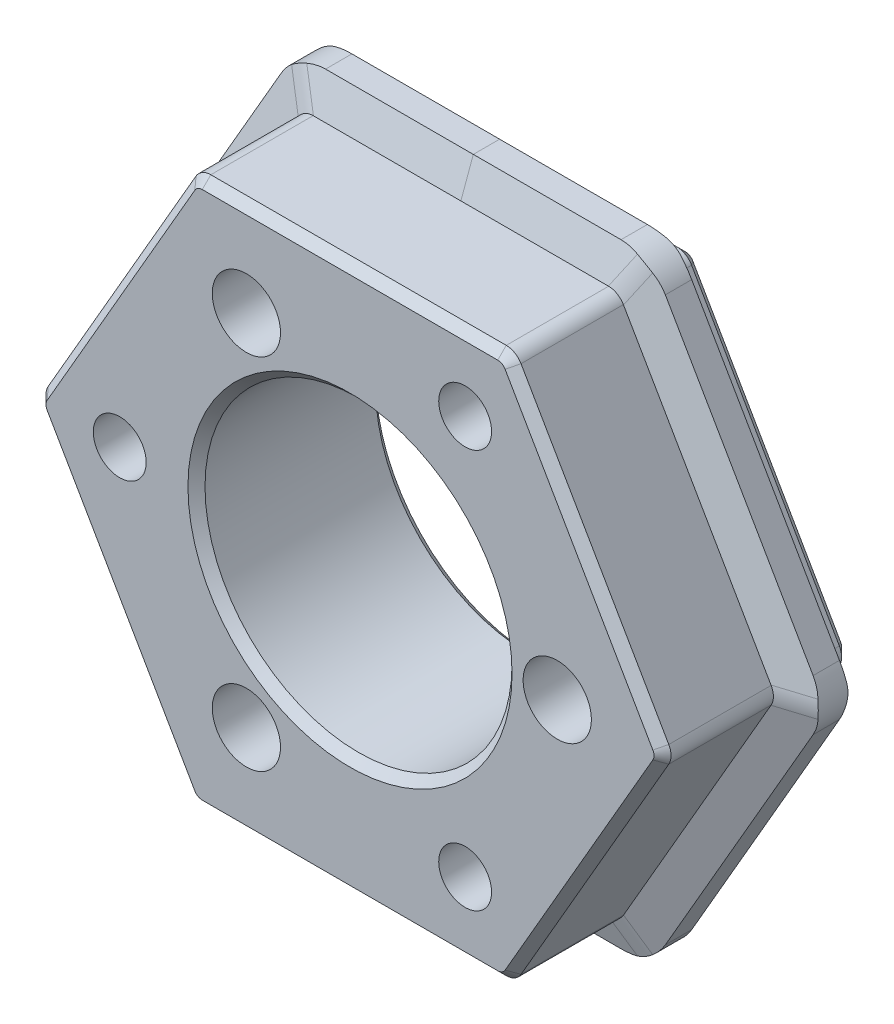
from build123d import *

# Parameters (mm, degrees)
EXTRUDE_1_DEPTH              = 5.5
HOLE_WIZARD_M3_1_D           = 3.1
HOLE_WIZARD_M3_1_CBORE_D     = 6
HOLE_WIZARD_M3_1_CBORE_DEPTH = 3.1
F_4_0MM_1_D                  = 4
F_4_0MM_1_DEPTH              = 3
F_4_0MM_1_TIP                = 1.2017212380551205
SKETCH_8_R                   = 9
CUT_EXTRUDE_1_DEPTH          = 27.801741236966944
FILLET_1_R                   = 3
FILLET_2_R                   = 1
CHAMFER_1_SIZE               = 0.5


with BuildPart() as part:
    # 草图2 → 凸台-拉伸1 (new, symmetric)
    with BuildSketch(Plane.XY):
        Polygon((9.237604307034019, 16.000000000000007), (-9.237604307034015, 16.000000000000007), (-18.475208614068023, -1.013e-14), (-9.237604307033997, -16.000000000000014), (9.237604307034022, -16.00000000000001), (18.475208614068038, 6.49e-15), align=None)
    extrude(amount=EXTRUDE_1_DEPTH, both=True)

    # M3 六角圆柱头螺钉的柱形沉头孔1 (through all)
    with Locations(Plane(origin=(0, 0, -5.5), x_dir=(-1, 0, 0), z_dir=(0, 0, -1))):
        with Locations((-6.75, 11.691342951), (13.5, 0), (-6.75, -11.691342951)):
            CounterBoreHole(HOLE_WIZARD_M3_1_D / 2, HOLE_WIZARD_M3_1_CBORE_D / 2, HOLE_WIZARD_M3_1_CBORE_DEPTH)

    # Ø4.0mm 暗销孔1
    with Locations(Plane.XY.offset(5.5)):
        with Locations((-6.075, 10.522208656), (12.15, 0), (-6.075, -10.522208656)):
            Hole(F_4_0MM_1_D / 2, depth=F_4_0MM_1_DEPTH)
            with Locations((0, 0, -(F_4_0MM_1_DEPTH + F_4_0MM_1_TIP / 2))):  # 118° drill point
                Cone(0, F_4_0MM_1_D / 2, F_4_0MM_1_TIP, mode=Mode.SUBTRACT)

    # 草图8 → 切除-拉伸1 (cut, through all)
    with BuildSketch(Plane.XY.offset(5.5)):
        Circle(SKETCH_8_R)
    extrude(amount=-CUT_EXTRUDE_1_DEPTH, mode=Mode.SUBTRACT)

    # 扫描1: sweep along a path in 草图10
    with BuildLine(Plane(origin=(0, 0, -2.4999999999999996), x_dir=(-1, 0, 0), z_dir=(0, 0, -1))) as sweep_1_path:
        Line((-9.237604307034019, 16.000000000000007), (-18.475208614068038, 6.49e-15))
        Line((-18.475208614068038, 6.49e-15), (-9.237604307034022, -16.00000000000001))
        Line((-9.237604307034022, -16.00000000000001), (9.237604307033997, -16.000000000000014))
        Line((9.237604307033997, -16.000000000000014), (18.475208614068023, -1.013e-14))
        Line((18.475208614068023, -1.013e-14), (9.237604307034015, 16.000000000000007))
        Line((9.237604307034015, 16.000000000000007), (-9.237604307034019, 16.000000000000007))
    # 草图11 → 扫描1 (sweep)
    with BuildSketch(Plane(origin=(0, 0, 0), x_dir=(0, 0, -1), z_dir=(1, 0, 0))):
        Polygon((1.0000000000000018, 16.00000000000001), (1.7279404685324007, 18.00000000000001), (3.2720595314676024, 18.00000000000001), (4.000000000000002, 16.000000000000007), align=None)
    sweep(path=sweep_1_path.line, transition=Transition.RIGHT)

    # 圆角1
    # the kernel refuses this fillet: 3 mm, written as the material it takes off along each edge
    with BuildSketch(Plane(origin=(11.013072226794984, -19.07520064423464, -2.8807185011023595), x_dir=(0.8275631402450503, 0.5371571559215875, 0.1630994750144294), z_dir=(-0.47687096271147394, 0.8259647360705569, -0.3006265784832199))) as fillet_1_piece_1_section:
        with BuildLine():
            CenterArc((FILLET_1_R * 0.173566836013, -FILLET_1_R), FILLET_1_R, 90.00000000000018, 19.693103879667916)
            Line((-FILLET_1_R * 0.163415104569, -FILLET_1_R * 0.0584888892203), (0, 0))
            Line((0, 0), (FILLET_1_R * 0.173566836013, 2e-17))
        make_face()
    fillet_1_piece_1 = extrude(amount=5.024913422108496, mode=Mode.PRIVATE)
    fillet_1_piece_1 = split(fillet_1_piece_1, bisect_by=Plane(origin=(8.777859638657976, -16.796301124136228, -3.4014164671004337), z_dir=(0.8660254037844388, -0.4999999999999997, 0)), keep=Keep.TOP, mode=Mode.PRIVATE)
    fillet_1_piece_1 = split(fillet_1_piece_1, bisect_by=Plane(origin=(10.157093643786105, -16.00000000000001, -3.4014164671004337), z_dir=(1.9e-16, -1, 0)), keep=Keep.TOP, mode=Mode.PRIVATE)
    add(fillet_1_piece_1, mode=Mode.SUBTRACT)
    with BuildSketch(Plane(origin=(11.013072226794984, -19.07520064423464, -2.8807185011023595), x_dir=(0.8275631402450503, 0.5371571559215875, 0.1630994750144294), z_dir=(-0.47687096271147394, 0.8259647360705569, -0.3006265784832199))) as fillet_1_piece_2_section:
        with BuildLine():
            CenterArc((FILLET_1_R * 0.173566836013, -FILLET_1_R), FILLET_1_R, 90.00000000000018, 19.693103879667916)
            Line((-FILLET_1_R * 0.163415104569, -FILLET_1_R * 0.0584888892203), (0, 0))
            Line((0, 0), (FILLET_1_R * 0.173566836013, 2e-17))
        make_face()
    fillet_1_piece_2 = extrude(amount=5.024913422108496, mode=Mode.PRIVATE)
    fillet_1_piece_2 = split(fillet_1_piece_2, bisect_by=Plane(origin=(9.094560258170244, -16.24775956035244, -3.9675238385528897), z_dir=(-0.8660254037844388, 0.4999999999999997, 0)), keep=Keep.TOP, mode=Mode.PRIVATE)
    fillet_1_piece_2 = split(fillet_1_piece_2, bisect_by=Plane(origin=(8.9515162091671, -16.00000000000001, -3.9675238385528897), z_dir=(1.9e-16, -1, 0)), keep=Keep.TOP, mode=Mode.PRIVATE)
    add(fillet_1_piece_2, mode=Mode.SUBTRACT)
    with BuildSketch(Plane(origin=(11.013072226794984, -19.07520064423464, -2.8807185011023595), x_dir=(0.8275631402450503, 0.5371571559215875, 0.1630994750144294), z_dir=(-0.47687096271147394, 0.8259647360705569, -0.3006265784832199))) as fillet_1_piece_3_section:
        with BuildLine():
            CenterArc((FILLET_1_R * 0.173566836013, -FILLET_1_R), FILLET_1_R, 90.00000000000018, 19.693103879667916)
            Line((-FILLET_1_R * 0.163415104569, -FILLET_1_R * 0.0584888892203), (0, 0))
            Line((0, 0), (FILLET_1_R * 0.173566836013, 2e-17))
        make_face()
    fillet_1_piece_3 = extrude(amount=5.024913422108496, mode=Mode.PRIVATE)
    fillet_1_piece_3 = split(fillet_1_piece_3, bisect_by=Plane(origin=(9.380648355967478, -15.752240439526894, -3.967523838552888), z_dir=(0.8660254037844388, -0.4999999999999997, 0)), keep=Keep.TOP, mode=Mode.PRIVATE)
    fillet_1_piece_3 = split(fillet_1_piece_3, bisect_by=Plane(origin=(9.523692404761562, -16.00000000000001, -3.967523838552888), z_dir=(-1.9e-16, 1, 0)), keep=Keep.TOP, mode=Mode.PRIVATE)
    add(fillet_1_piece_3, mode=Mode.SUBTRACT)
    with BuildSketch(Plane(origin=(8.616836925652304, -14.924799355765398, -0.6086589696347597), x_dir=(0.8275631402450506, 0.5371571559215875, -0.16309947501442706), z_dir=(0.47687096271147433, -0.8259647360705564, -0.3006265784832201))) as fillet_1_piece_4_section:
        with BuildLine():
            CenterArc((FILLET_1_R * 0.173566836013, -FILLET_1_R), FILLET_1_R, 90, 19.693103879668044)
            Line((-FILLET_1_R * 0.163415104569, -FILLET_1_R * 0.0584888892203), (0, 0))
            Line((0, 0), (FILLET_1_R * 0.173566836013, 1e-17))
        make_face()
    fillet_1_piece_4 = extrude(amount=5.024913422108493, mode=Mode.PRIVATE)
    fillet_1_piece_4 = split(fillet_1_piece_4, bisect_by=Plane(origin=(9.094560258170246, -16.24775956035244, -1.0324761614471132), z_dir=(-0.8660254037844388, 0.4999999999999997, 0)), keep=Keep.TOP, mode=Mode.PRIVATE)
    fillet_1_piece_4 = split(fillet_1_piece_4, bisect_by=Plane(origin=(8.951516209167089, -16.00000000000001, -1.0324761614471132), z_dir=(1.9e-16, -1, 0)), keep=Keep.TOP, mode=Mode.PRIVATE)
    add(fillet_1_piece_4, mode=Mode.SUBTRACT)
    with BuildSketch(Plane(origin=(8.616836925652304, -14.924799355765398, -0.6086589696347597), x_dir=(0.8275631402450506, 0.5371571559215875, -0.16309947501442706), z_dir=(0.47687096271147433, -0.8259647360705564, -0.3006265784832201))) as fillet_1_piece_5_section:
        with BuildLine():
            CenterArc((FILLET_1_R * 0.173566836013, -FILLET_1_R), FILLET_1_R, 90, 19.693103879668044)
            Line((-FILLET_1_R * 0.163415104569, -FILLET_1_R * 0.0584888892203), (0, 0))
            Line((0, 0), (FILLET_1_R * 0.173566836013, 1e-17))
        make_face()
    fillet_1_piece_5 = extrude(amount=5.024913422108493, mode=Mode.PRIVATE)
    fillet_1_piece_5 = split(fillet_1_piece_5, bisect_by=Plane(origin=(9.380648355967471, -15.752240439526908, -1.032476161447135), z_dir=(0.8660254037844388, -0.4999999999999997, 0)), keep=Keep.TOP, mode=Mode.PRIVATE)
    fillet_1_piece_5 = split(fillet_1_piece_5, bisect_by=Plane(origin=(9.523692404761544, -16.00000000000001, -1.032476161447135), z_dir=(-1.9e-16, 1, 0)), keep=Keep.TOP, mode=Mode.PRIVATE)
    add(fillet_1_piece_5, mode=Mode.SUBTRACT)
    with BuildSketch(Plane(origin=(8.616836925652304, -14.924799355765398, -0.6086589696347597), x_dir=(0.8275631402450506, 0.5371571559215875, -0.16309947501442706), z_dir=(0.47687096271147433, -0.8259647360705564, -0.3006265784832201))) as fillet_1_piece_6_section:
        with BuildLine():
            CenterArc((FILLET_1_R * 0.173566836013, -FILLET_1_R), FILLET_1_R, 90, 19.693103879668044)
            Line((-FILLET_1_R * 0.163415104569, -FILLET_1_R * 0.0584888892203), (0, 0))
            Line((0, 0), (FILLET_1_R * 0.173566836013, 1e-17))
        make_face()
    fillet_1_piece_6 = extrude(amount=5.024913422108493, mode=Mode.PRIVATE)
    fillet_1_piece_6 = split(fillet_1_piece_6, bisect_by=Plane(origin=(8.777859638657999, -16.79630112413619, -1.598583532899566), z_dir=(0.8660254037844388, -0.4999999999999997, 0)), keep=Keep.TOP, mode=Mode.PRIVATE)
    fillet_1_piece_6 = split(fillet_1_piece_6, bisect_by=Plane(origin=(10.157093643786116, -16.00000000000001, -1.598583532899566), z_dir=(1.9e-16, -1, 0)), keep=Keep.TOP, mode=Mode.PRIVATE)
    add(fillet_1_piece_6, mode=Mode.SUBTRACT)
    with BuildSketch(Plane(origin=(10.392304845413273, -18.000000000000014, 2.602186550389802), x_dir=(0.4999999999999995, 0.8660254037844389, 0), z_dir=(1.3e-16, 1e-17, -1))) as fillet_1_piece_7:
        with BuildLine():
            CenterArc((FILLET_1_R * 0.57735026919, -FILLET_1_R), FILLET_1_R, 90.00000000000004, 59.99999999999996)
            Line((-FILLET_1_R * 0.288675134595, -FILLET_1_R * 0.5), (0, 0))
            Line((0, 0), (FILLET_1_R * 0.57735026919, -3e-17))
        make_face()
    extrude(amount=10.204373100779607, mode=Mode.SUBTRACT)
    with BuildSketch(Plane(origin=(22.02614445358997, -7.11e-15, -2.8807185011023595), x_dir=(-0.051410172730167014, 0.9852692806486323, 0.16309947501442495), z_dir=(-0.9537419254229482, 0, -0.30062657848321994))) as fillet_1_piece_8_section:
        with BuildLine():
            CenterArc((FILLET_1_R * 0.173566836013, -FILLET_1_R), FILLET_1_R, 89.9999999999999, 19.693103879668058)
            Line((-FILLET_1_R * 0.163415104569, -FILLET_1_R * 0.0584888892203), (0, 0))
            Line((0, 0), (FILLET_1_R * 0.173566836013, 0))
        make_face()
    fillet_1_piece_8 = extrude(amount=5.024913422108487, mode=Mode.PRIVATE)
    fillet_1_piece_8 = split(fillet_1_piece_8, bisect_by=Plane(origin=(18.93495328244408, -0.796301124136203, -3.4014164671004345), z_dir=(0.8660254037844385, 0.5000000000000003, 0)), keep=Keep.TOP, mode=Mode.PRIVATE)
    fillet_1_piece_8 = split(fillet_1_piece_8, bisect_by=Plane(origin=(18.934953282444077, 0.7963011241362139, -3.4014164671004345), z_dir=(0.8660254037844388, -0.4999999999999997, 0)), keep=Keep.TOP, mode=Mode.PRIVATE)
    add(fillet_1_piece_8, mode=Mode.SUBTRACT)
    with BuildSketch(Plane(origin=(22.02614445358997, -7.11e-15, -2.8807185011023595), x_dir=(-0.051410172730167014, 0.9852692806486323, 0.16309947501442495), z_dir=(-0.9537419254229482, 0, -0.30062657848321994))) as fillet_1_piece_9_section:
        with BuildLine():
            CenterArc((FILLET_1_R * 0.173566836013, -FILLET_1_R), FILLET_1_R, 89.9999999999999, 19.693103879668058)
            Line((-FILLET_1_R * 0.163415104569, -FILLET_1_R * 0.0584888892203), (0, 0))
            Line((0, 0), (FILLET_1_R * 0.173566836013, 0))
        make_face()
    fillet_1_piece_9 = extrude(amount=5.024913422108487, mode=Mode.PRIVATE)
    fillet_1_piece_9 = split(fillet_1_piece_9, bisect_by=Plane(origin=(18.618252662931823, -0.24775956035243224, -3.9675238385528875), z_dir=(-0.8660254037844385, -0.5000000000000003, 0)), keep=Keep.TOP, mode=Mode.PRIVATE)
    fillet_1_piece_9 = split(fillet_1_piece_9, bisect_by=Plane(origin=(18.332164565134576, -0.2477595604731171, -3.9675238385528875), z_dir=(0.8660254037844388, -0.4999999999999997, 0)), keep=Keep.TOP, mode=Mode.PRIVATE)
    add(fillet_1_piece_9, mode=Mode.SUBTRACT)
    with BuildSketch(Plane(origin=(22.02614445358997, -7.11e-15, -2.8807185011023595), x_dir=(-0.051410172730167014, 0.9852692806486323, 0.16309947501442495), z_dir=(-0.9537419254229482, 0, -0.30062657848321994))) as fillet_1_piece_10_section:
        with BuildLine():
            CenterArc((FILLET_1_R * 0.173566836013, -FILLET_1_R), FILLET_1_R, 89.9999999999999, 19.693103879668058)
            Line((-FILLET_1_R * 0.163415104569, -FILLET_1_R * 0.0584888892203), (0, 0))
            Line((0, 0), (FILLET_1_R * 0.173566836013, 0))
        make_face()
    fillet_1_piece_10 = extrude(amount=5.024913422108487, mode=Mode.PRIVATE)
    fillet_1_piece_10 = split(fillet_1_piece_10, bisect_by=Plane(origin=(18.332164565134583, 0.2477595604731165, -3.9675238385528857), z_dir=(0.8660254037844385, 0.5000000000000003, 0)), keep=Keep.TOP, mode=Mode.PRIVATE)
    fillet_1_piece_10 = split(fillet_1_piece_10, bisect_by=Plane(origin=(18.618252662931802, 0.24775956035241364, -3.9675238385528857), z_dir=(-0.8660254037844388, 0.4999999999999997, 0)), keep=Keep.TOP, mode=Mode.PRIVATE)
    add(fillet_1_piece_10, mode=Mode.SUBTRACT)
    with BuildSketch(Plane(origin=(17.233673851304612, -7.11e-15, -0.6086589696347613), x_dir=(-0.05141017273016725, 0.9852692806486322, -0.1630994750144251), z_dir=(0.9537419254229481, 0, -0.30062657848322005))) as fillet_1_piece_11_section:
        with BuildLine():
            CenterArc((FILLET_1_R * 0.173566836013, -FILLET_1_R), FILLET_1_R, 89.99999999999991, 19.693103879668)
            Line((-FILLET_1_R * 0.163415104569, -FILLET_1_R * 0.0584888892203), (0, 0))
            Line((0, 0), (FILLET_1_R * 0.173566836013, 1e-17))
        make_face()
    fillet_1_piece_11 = extrude(amount=5.02491342210849, mode=Mode.PRIVATE)
    fillet_1_piece_11 = split(fillet_1_piece_11, bisect_by=Plane(origin=(18.618252662931823, -0.24775956035243224, -1.0324761614471145), z_dir=(-0.8660254037844385, -0.5000000000000003, 0)), keep=Keep.TOP, mode=Mode.PRIVATE)
    fillet_1_piece_11 = split(fillet_1_piece_11, bisect_by=Plane(origin=(18.332164565134576, -0.24775956047311354, -1.0324761614471145), z_dir=(0.8660254037844388, -0.4999999999999997, 0)), keep=Keep.TOP, mode=Mode.PRIVATE)
    add(fillet_1_piece_11, mode=Mode.SUBTRACT)
    with BuildSketch(Plane(origin=(17.233673851304612, -7.11e-15, -0.6086589696347613), x_dir=(-0.05141017273016725, 0.9852692806486322, -0.1630994750144251), z_dir=(0.9537419254229481, 0, -0.30062657848322005))) as fillet_1_piece_12_section:
        with BuildLine():
            CenterArc((FILLET_1_R * 0.173566836013, -FILLET_1_R), FILLET_1_R, 89.99999999999991, 19.693103879668)
            Line((-FILLET_1_R * 0.163415104569, -FILLET_1_R * 0.0584888892203), (0, 0))
            Line((0, 0), (FILLET_1_R * 0.173566836013, 1e-17))
        make_face()
    fillet_1_piece_12 = extrude(amount=5.02491342210849, mode=Mode.PRIVATE)
    fillet_1_piece_12 = split(fillet_1_piece_12, bisect_by=Plane(origin=(18.332164565134583, 0.24775956047311498, -1.0324761614471158), z_dir=(0.8660254037844385, 0.5000000000000003, 0)), keep=Keep.TOP, mode=Mode.PRIVATE)
    fillet_1_piece_12 = split(fillet_1_piece_12, bisect_by=Plane(origin=(18.618252662931802, 0.24775956035241364, -1.0324761614471158), z_dir=(-0.8660254037844388, 0.4999999999999997, 0)), keep=Keep.TOP, mode=Mode.PRIVATE)
    add(fillet_1_piece_12, mode=Mode.SUBTRACT)
    with BuildSketch(Plane(origin=(17.233673851304612, -7.11e-15, -0.6086589696347613), x_dir=(-0.05141017273016725, 0.9852692806486322, -0.1630994750144251), z_dir=(0.9537419254229481, 0, -0.30062657848322005))) as fillet_1_piece_13_section:
        with BuildLine():
            CenterArc((FILLET_1_R * 0.173566836013, -FILLET_1_R), FILLET_1_R, 89.99999999999991, 19.693103879668)
            Line((-FILLET_1_R * 0.163415104569, -FILLET_1_R * 0.0584888892203), (0, 0))
            Line((0, 0), (FILLET_1_R * 0.173566836013, 1e-17))
        make_face()
    fillet_1_piece_13 = extrude(amount=5.02491342210849, mode=Mode.PRIVATE)
    fillet_1_piece_13 = split(fillet_1_piece_13, bisect_by=Plane(origin=(18.934953282444077, -0.7963011241361984, -1.5985835328995615), z_dir=(0.8660254037844385, 0.5000000000000003, 0)), keep=Keep.TOP, mode=Mode.PRIVATE)
    fillet_1_piece_13 = split(fillet_1_piece_13, bisect_by=Plane(origin=(18.934953282444077, 0.7963011241362103, -1.5985835328995615), z_dir=(0.8660254037844388, -0.4999999999999997, 0)), keep=Keep.TOP, mode=Mode.PRIVATE)
    add(fillet_1_piece_13, mode=Mode.SUBTRACT)
    with BuildSketch(Plane(origin=(20.78460969082654, -3.55e-15, 2.6021865503897903), x_dir=(-0.5000000000000008, 0.8660254037844382, 0), z_dir=(1.3e-16, 0, -1))) as fillet_1_piece_14:
        with BuildLine():
            CenterArc((FILLET_1_R * 0.57735026919, -FILLET_1_R), FILLET_1_R, 90.00000000000006, 59.999999999999886)
            Line((-FILLET_1_R * 0.288675134595, -FILLET_1_R * 0.5), (0, 0))
            Line((0, 0), (FILLET_1_R * 0.57735026919, 6e-17))
        make_face()
    extrude(amount=10.204373100779584, mode=Mode.SUBTRACT)
    with BuildSketch(Plane(origin=(-11.013072226794975, -19.075200644234645, -2.880718501102355), x_dir=(-0.8275631402450514, 0.5371571559215865, 0.1630994750144262), z_dir=(0.47687096271147367, 0.825964736070557, -0.3006265784832199))) as fillet_1_piece_15_section:
        with BuildLine():
            CenterArc((FILLET_1_R * 0.173566836013, FILLET_1_R), FILLET_1_R, 250.306896120332, 19.693103879668)
            Line((-FILLET_1_R * 0.163415104569, FILLET_1_R * 0.0584888892203), (0, 0))
            Line((0, 0), (FILLET_1_R * 0.173566836013, 2e-17))
        make_face()
    fillet_1_piece_15 = extrude(amount=5.02491342210852, mode=Mode.PRIVATE)
    fillet_1_piece_15 = split(fillet_1_piece_15, bisect_by=Plane(origin=(-8.777859638657953, -16.796301124136228, -3.4014164671004337), z_dir=(-0.8660254037844384, -0.5000000000000004, 0)), keep=Keep.TOP, mode=Mode.PRIVATE)
    fillet_1_piece_15 = split(fillet_1_piece_15, bisect_by=Plane(origin=(-10.157093643786064, -16.000000000000014, -3.4014164671004337), z_dir=(1.9e-16, -1, 0)), keep=Keep.TOP, mode=Mode.PRIVATE)
    add(fillet_1_piece_15, mode=Mode.SUBTRACT)
    with BuildSketch(Plane(origin=(-11.013072226794975, -19.075200644234645, -2.880718501102355), x_dir=(-0.8275631402450514, 0.5371571559215865, 0.1630994750144262), z_dir=(0.47687096271147367, 0.825964736070557, -0.3006265784832199))) as fillet_1_piece_16_section:
        with BuildLine():
            CenterArc((FILLET_1_R * 0.173566836013, FILLET_1_R), FILLET_1_R, 250.306896120332, 19.693103879668)
            Line((-FILLET_1_R * 0.163415104569, FILLET_1_R * 0.0584888892203), (0, 0))
            Line((0, 0), (FILLET_1_R * 0.173566836013, 2e-17))
        make_face()
    fillet_1_piece_16 = extrude(amount=5.02491342210852, mode=Mode.PRIVATE)
    fillet_1_piece_16 = split(fillet_1_piece_16, bisect_by=Plane(origin=(-9.094560258170233, -16.247759560352417, -3.967523838552873), z_dir=(0.8660254037844384, 0.5000000000000004, 0)), keep=Keep.TOP, mode=Mode.PRIVATE)
    fillet_1_piece_16 = split(fillet_1_piece_16, bisect_by=Plane(origin=(-8.951516209167098, -16.000000000000014, -3.967523838552873), z_dir=(1.9e-16, -1, 0)), keep=Keep.TOP, mode=Mode.PRIVATE)
    add(fillet_1_piece_16, mode=Mode.SUBTRACT)
    with BuildSketch(Plane(origin=(-11.013072226794975, -19.075200644234645, -2.880718501102355), x_dir=(-0.8275631402450514, 0.5371571559215865, 0.1630994750144262), z_dir=(0.47687096271147367, 0.825964736070557, -0.3006265784832199))) as fillet_1_piece_17_section:
        with BuildLine():
            CenterArc((FILLET_1_R * 0.173566836013, FILLET_1_R), FILLET_1_R, 250.306896120332, 19.693103879668)
            Line((-FILLET_1_R * 0.163415104569, FILLET_1_R * 0.0584888892203), (0, 0))
            Line((0, 0), (FILLET_1_R * 0.173566836013, 2e-17))
        make_face()
    fillet_1_piece_17 = extrude(amount=5.02491342210852, mode=Mode.PRIVATE)
    fillet_1_piece_17 = split(fillet_1_piece_17, bisect_by=Plane(origin=(-9.380648355967464, -15.752240439526881, -3.96752383855289), z_dir=(-0.8660254037844384, -0.5000000000000004, 0)), keep=Keep.TOP, mode=Mode.PRIVATE)
    fillet_1_piece_17 = split(fillet_1_piece_17, bisect_by=Plane(origin=(-9.523692404761562, -16.000000000000014, -3.96752383855289), z_dir=(-1.9e-16, 1, 0)), keep=Keep.TOP, mode=Mode.PRIVATE)
    add(fillet_1_piece_17, mode=Mode.SUBTRACT)
    with BuildSketch(Plane(origin=(-8.61683692565229, -14.924799355765401, -0.6086589696347612), x_dir=(-0.8275631402450508, 0.5371571559215872, -0.16309947501442718), z_dir=(-0.47687096271147406, -0.8259647360705566, -0.3006265784832201))) as fillet_1_piece_18_section:
        with BuildLine():
            CenterArc((FILLET_1_R * 0.173566836013, FILLET_1_R), FILLET_1_R, 250.306896120332, 19.693103879668)
            Line((-FILLET_1_R * 0.163415104569, FILLET_1_R * 0.0584888892203), (0, 0))
            Line((0, 0), (FILLET_1_R * 0.173566836013, 0))
        make_face()
    fillet_1_piece_18 = extrude(amount=5.024913422108482, mode=Mode.PRIVATE)
    fillet_1_piece_18 = split(fillet_1_piece_18, bisect_by=Plane(origin=(-9.094560258170242, -16.247759560352403, -1.0324761614471423), z_dir=(0.8660254037844384, 0.5000000000000004, 0)), keep=Keep.TOP, mode=Mode.PRIVATE)
    fillet_1_piece_18 = split(fillet_1_piece_18, bisect_by=Plane(origin=(-8.951516209167114, -16.000000000000014, -1.0324761614471423), z_dir=(1.9e-16, -1, 0)), keep=Keep.TOP, mode=Mode.PRIVATE)
    add(fillet_1_piece_18, mode=Mode.SUBTRACT)
    with BuildSketch(Plane(origin=(-8.61683692565229, -14.924799355765401, -0.6086589696347612), x_dir=(-0.8275631402450508, 0.5371571559215872, -0.16309947501442718), z_dir=(-0.47687096271147406, -0.8259647360705566, -0.3006265784832201))) as fillet_1_piece_19_section:
        with BuildLine():
            CenterArc((FILLET_1_R * 0.173566836013, FILLET_1_R), FILLET_1_R, 250.306896120332, 19.693103879668)
            Line((-FILLET_1_R * 0.163415104569, FILLET_1_R * 0.0584888892203), (0, 0))
            Line((0, 0), (FILLET_1_R * 0.173566836013, 0))
        make_face()
    fillet_1_piece_19 = extrude(amount=5.024913422108482, mode=Mode.PRIVATE)
    fillet_1_piece_19 = split(fillet_1_piece_19, bisect_by=Plane(origin=(-9.380648355967462, -15.752240439526885, -1.0324761614471119), z_dir=(-0.8660254037844384, -0.5000000000000004, 0)), keep=Keep.TOP, mode=Mode.PRIVATE)
    fillet_1_piece_19 = split(fillet_1_piece_19, bisect_by=Plane(origin=(-9.523692404761558, -16.000000000000014, -1.0324761614471119), z_dir=(-1.9e-16, 1, 0)), keep=Keep.TOP, mode=Mode.PRIVATE)
    add(fillet_1_piece_19, mode=Mode.SUBTRACT)
    with BuildSketch(Plane(origin=(-8.61683692565229, -14.924799355765401, -0.6086589696347612), x_dir=(-0.8275631402450508, 0.5371571559215872, -0.16309947501442718), z_dir=(-0.47687096271147406, -0.8259647360705566, -0.3006265784832201))) as fillet_1_piece_20_section:
        with BuildLine():
            CenterArc((FILLET_1_R * 0.173566836013, FILLET_1_R), FILLET_1_R, 250.306896120332, 19.693103879668)
            Line((-FILLET_1_R * 0.163415104569, FILLET_1_R * 0.0584888892203), (0, 0))
            Line((0, 0), (FILLET_1_R * 0.173566836013, 0))
        make_face()
    fillet_1_piece_20 = extrude(amount=5.024913422108482, mode=Mode.PRIVATE)
    fillet_1_piece_20 = split(fillet_1_piece_20, bisect_by=Plane(origin=(-8.777859638657972, -16.796301124136193, -1.5985835328995448), z_dir=(-0.8660254037844384, -0.5000000000000004, 0)), keep=Keep.TOP, mode=Mode.PRIVATE)
    fillet_1_piece_20 = split(fillet_1_piece_20, bisect_by=Plane(origin=(-10.157093643786016, -16.000000000000014, -1.5985835328995448), z_dir=(1.9e-16, -1, 0)), keep=Keep.TOP, mode=Mode.PRIVATE)
    add(fillet_1_piece_20, mode=Mode.SUBTRACT)
    with BuildSketch(Plane(origin=(-10.392304845413252, -18.000000000000014, 2.602186550389791), x_dir=(-0.500000000000001, 0.866025403784438, 0), z_dir=(-1.3e-16, 1e-17, -1))) as fillet_1_piece_21:
        with BuildLine():
            CenterArc((FILLET_1_R * 0.57735026919, FILLET_1_R), FILLET_1_R, 210, 60)
            Line((-FILLET_1_R * 0.288675134595, FILLET_1_R * 0.5), (0, 0))
            Line((0, 0), (FILLET_1_R * 0.57735026919, -6e-17))
        make_face()
    extrude(amount=10.204373100779586, mode=Mode.SUBTRACT)
    with BuildSketch(Plane(origin=(10.392304845413275, 18.00000000000001, 2.6021865503897947), x_dir=(-1, 0, -1.3e-16), z_dir=(1.3e-16, 0, -1))) as fillet_1_piece_22:
        with BuildLine():
            CenterArc((FILLET_1_R * 0.57735026919, -FILLET_1_R), FILLET_1_R, 90, 60)
            Line((-FILLET_1_R * 0.288675134595, -FILLET_1_R * 0.5), (0, 0))
            Line((0, 0), (FILLET_1_R * 0.57735026919, 0))
        make_face()
    extrude(amount=10.204373100779593, mode=Mode.SUBTRACT)
    with BuildSketch(Plane(origin=(8.616836925652304, 14.92479935576539, -0.6086589696347584), x_dir=(-0.8789733129752185, 0.4481121247270451, -0.16309947501442743), z_dir=(0.47687096271147456, 0.8259647360705563, -0.30062657848322005))) as fillet_1_piece_23_section:
        with BuildLine():
            CenterArc((FILLET_1_R * 0.173566836013, -FILLET_1_R), FILLET_1_R, 90.00000000000003, 19.693103879668058)
            Line((-FILLET_1_R * 0.163415104569, -FILLET_1_R * 0.0584888892203), (0, 0))
            Line((0, 0), (FILLET_1_R * 0.173566836013, -2e-17))
        make_face()
    fillet_1_piece_23 = extrude(amount=5.0249134221084955, mode=Mode.PRIVATE)
    fillet_1_piece_23 = split(fillet_1_piece_23, bisect_by=Plane(origin=(9.523692404761574, 16.000000000000007, -1.0324761614471116), z_dir=(0, -1, 0)), keep=Keep.TOP, mode=Mode.PRIVATE)
    fillet_1_piece_23 = split(fillet_1_piece_23, bisect_by=Plane(origin=(9.380648355967484, 15.752240439526876, -1.0324761614471116), z_dir=(0.8660254037844385, 0.5000000000000003, 0)), keep=Keep.TOP, mode=Mode.PRIVATE)
    add(fillet_1_piece_23, mode=Mode.SUBTRACT)
    with BuildSketch(Plane(origin=(8.616836925652304, 14.92479935576539, -0.6086589696347584), x_dir=(-0.8789733129752185, 0.4481121247270451, -0.16309947501442743), z_dir=(0.47687096271147456, 0.8259647360705563, -0.30062657848322005))) as fillet_1_piece_24_section:
        with BuildLine():
            CenterArc((FILLET_1_R * 0.173566836013, -FILLET_1_R), FILLET_1_R, 90.00000000000003, 19.693103879668058)
            Line((-FILLET_1_R * 0.163415104569, -FILLET_1_R * 0.0584888892203), (0, 0))
            Line((0, 0), (FILLET_1_R * 0.173566836013, -2e-17))
        make_face()
    fillet_1_piece_24 = extrude(amount=5.0249134221084955, mode=Mode.PRIVATE)
    fillet_1_piece_24 = split(fillet_1_piece_24, bisect_by=Plane(origin=(8.951516209167094, 16.000000000000007, -1.0324761614471134), z_dir=(0, 1, 0)), keep=Keep.TOP, mode=Mode.PRIVATE)
    fillet_1_piece_24 = split(fillet_1_piece_24, bisect_by=Plane(origin=(9.094560258170242, 16.247759560352428, -1.0324761614471134), z_dir=(-0.8660254037844385, -0.5000000000000003, 0)), keep=Keep.TOP, mode=Mode.PRIVATE)
    add(fillet_1_piece_24, mode=Mode.SUBTRACT)
    with BuildSketch(Plane(origin=(8.616836925652304, 14.92479935576539, -0.6086589696347584), x_dir=(-0.8789733129752185, 0.4481121247270451, -0.16309947501442743), z_dir=(0.47687096271147456, 0.8259647360705563, -0.30062657848322005))) as fillet_1_piece_25_section:
        with BuildLine():
            CenterArc((FILLET_1_R * 0.173566836013, -FILLET_1_R), FILLET_1_R, 90.00000000000003, 19.693103879668058)
            Line((-FILLET_1_R * 0.163415104569, -FILLET_1_R * 0.0584888892203), (0, 0))
            Line((0, 0), (FILLET_1_R * 0.173566836013, -2e-17))
        make_face()
    fillet_1_piece_25 = extrude(amount=5.0249134221084955, mode=Mode.PRIVATE)
    fillet_1_piece_25 = split(fillet_1_piece_25, bisect_by=Plane(origin=(10.157093643786139, 16.000000000000007, -1.5985835328995903), z_dir=(0, 1, 0)), keep=Keep.TOP, mode=Mode.PRIVATE)
    fillet_1_piece_25 = split(fillet_1_piece_25, bisect_by=Plane(origin=(8.777859638657954, 16.79630112413625, -1.5985835328995903), z_dir=(0.8660254037844385, 0.5000000000000003, 0)), keep=Keep.TOP, mode=Mode.PRIVATE)
    add(fillet_1_piece_25, mode=Mode.SUBTRACT)
    with BuildSketch(Plane(origin=(11.01307222679499, 19.07520064423463, -2.8807185011023595), x_dir=(-0.8789733129752189, 0.4481121247270446, 0.16309947501442676), z_dir=(-0.47687096271147394, -0.8259647360705569, -0.30062657848321983))) as fillet_1_piece_26_section:
        with BuildLine():
            CenterArc((FILLET_1_R * 0.173566836013, -FILLET_1_R), FILLET_1_R, 90.00000000000001, 19.693103879668)
            Line((-FILLET_1_R * 0.163415104569, -FILLET_1_R * 0.0584888892203), (0, 0))
            Line((0, 0), (FILLET_1_R * 0.173566836013, -1e-17))
        make_face()
    fillet_1_piece_26 = extrude(amount=5.024913422108505, mode=Mode.PRIVATE)
    fillet_1_piece_26 = split(fillet_1_piece_26, bisect_by=Plane(origin=(10.15709364378612, 16.000000000000007, -3.4014164671004234), z_dir=(0, 1, 0)), keep=Keep.TOP, mode=Mode.PRIVATE)
    fillet_1_piece_26 = split(fillet_1_piece_26, bisect_by=Plane(origin=(8.777859638657961, 16.79630112413624, -3.4014164671004234), z_dir=(0.8660254037844385, 0.5000000000000003, 0)), keep=Keep.TOP, mode=Mode.PRIVATE)
    add(fillet_1_piece_26, mode=Mode.SUBTRACT)
    with BuildSketch(Plane(origin=(11.01307222679499, 19.07520064423463, -2.8807185011023595), x_dir=(-0.8789733129752189, 0.4481121247270446, 0.16309947501442676), z_dir=(-0.47687096271147394, -0.8259647360705569, -0.30062657848321983))) as fillet_1_piece_27_section:
        with BuildLine():
            CenterArc((FILLET_1_R * 0.173566836013, -FILLET_1_R), FILLET_1_R, 90.00000000000001, 19.693103879668)
            Line((-FILLET_1_R * 0.163415104569, -FILLET_1_R * 0.0584888892203), (0, 0))
            Line((0, 0), (FILLET_1_R * 0.173566836013, -1e-17))
        make_face()
    fillet_1_piece_27 = extrude(amount=5.024913422108505, mode=Mode.PRIVATE)
    fillet_1_piece_27 = split(fillet_1_piece_27, bisect_by=Plane(origin=(9.523692404761569, 16.000000000000007, -3.9675238385528897), z_dir=(0, -1, 0)), keep=Keep.TOP, mode=Mode.PRIVATE)
    fillet_1_piece_27 = split(fillet_1_piece_27, bisect_by=Plane(origin=(9.380648355967478, 15.752240439526885, -3.9675238385528897), z_dir=(0.8660254037844385, 0.5000000000000003, 0)), keep=Keep.TOP, mode=Mode.PRIVATE)
    add(fillet_1_piece_27, mode=Mode.SUBTRACT)
    with BuildSketch(Plane(origin=(11.01307222679499, 19.07520064423463, -2.8807185011023595), x_dir=(-0.8789733129752189, 0.4481121247270446, 0.16309947501442676), z_dir=(-0.47687096271147394, -0.8259647360705569, -0.30062657848321983))) as fillet_1_piece_28_section:
        with BuildLine():
            CenterArc((FILLET_1_R * 0.173566836013, -FILLET_1_R), FILLET_1_R, 90.00000000000001, 19.693103879668)
            Line((-FILLET_1_R * 0.163415104569, -FILLET_1_R * 0.0584888892203), (0, 0))
            Line((0, 0), (FILLET_1_R * 0.173566836013, -1e-17))
        make_face()
    fillet_1_piece_28 = extrude(amount=5.024913422108505, mode=Mode.PRIVATE)
    fillet_1_piece_28 = split(fillet_1_piece_28, bisect_by=Plane(origin=(8.951516209167098, 16.000000000000007, -3.9675238385528857), z_dir=(0, 1, 0)), keep=Keep.TOP, mode=Mode.PRIVATE)
    fillet_1_piece_28 = split(fillet_1_piece_28, bisect_by=Plane(origin=(9.094560258170242, 16.247759560352428, -3.9675238385528857), z_dir=(-0.8660254037844385, -0.5000000000000003, 0)), keep=Keep.TOP, mode=Mode.PRIVATE)
    add(fillet_1_piece_28, mode=Mode.SUBTRACT)
    with BuildSketch(Plane(origin=(-22.026144453589964, -1.565e-14, -2.88071850110236), x_dir=(0.05141017273016661, 0.9852692806486325, 0.16309947501442484), z_dir=(0.9537419254229482, 0, -0.30062657848321983))) as fillet_1_piece_29_section:
        with BuildLine():
            CenterArc((FILLET_1_R * 0.173566836013, FILLET_1_R), FILLET_1_R, 250.3068961203321, 19.693103879668)
            Line((-FILLET_1_R * 0.163415104569, FILLET_1_R * 0.0584888892203), (0, 0))
            Line((0, 0), (FILLET_1_R * 0.173566836013, -1e-17))
        make_face()
    fillet_1_piece_29 = extrude(amount=5.024913422108501, mode=Mode.PRIVATE)
    fillet_1_piece_29 = split(fillet_1_piece_29, bisect_by=Plane(origin=(-18.93495328244407, -0.7963011241362281, -3.4014164671004368), z_dir=(-0.866025403784439, 0.49999999999999944, 0)), keep=Keep.TOP, mode=Mode.PRIVATE)
    fillet_1_piece_29 = split(fillet_1_piece_29, bisect_by=Plane(origin=(-18.93495328244406, 0.79630112413619, -3.4014164671004368), z_dir=(-0.8660254037844384, -0.5000000000000004, 0)), keep=Keep.TOP, mode=Mode.PRIVATE)
    add(fillet_1_piece_29, mode=Mode.SUBTRACT)
    with BuildSketch(Plane(origin=(-22.026144453589964, -1.565e-14, -2.88071850110236), x_dir=(0.05141017273016661, 0.9852692806486325, 0.16309947501442484), z_dir=(0.9537419254229482, 0, -0.30062657848321983))) as fillet_1_piece_30_section:
        with BuildLine():
            CenterArc((FILLET_1_R * 0.173566836013, FILLET_1_R), FILLET_1_R, 250.3068961203321, 19.693103879668)
            Line((-FILLET_1_R * 0.163415104569, FILLET_1_R * 0.0584888892203), (0, 0))
            Line((0, 0), (FILLET_1_R * 0.173566836013, -1e-17))
        make_face()
    fillet_1_piece_30 = extrude(amount=5.024913422108501, mode=Mode.PRIVATE)
    fillet_1_piece_30 = split(fillet_1_piece_30, bisect_by=Plane(origin=(-18.618252662931795, -0.24775956035242785, -3.9675238385528875), z_dir=(0.866025403784439, -0.49999999999999944, 0)), keep=Keep.TOP, mode=Mode.PRIVATE)
    fillet_1_piece_30 = split(fillet_1_piece_30, bisect_by=Plane(origin=(-18.332164565134565, -0.2477595604731278, -3.9675238385528875), z_dir=(-0.8660254037844384, -0.5000000000000004, 0)), keep=Keep.TOP, mode=Mode.PRIVATE)
    add(fillet_1_piece_30, mode=Mode.SUBTRACT)
    with BuildSketch(Plane(origin=(-22.026144453589964, -1.565e-14, -2.88071850110236), x_dir=(0.05141017273016661, 0.9852692806486325, 0.16309947501442484), z_dir=(0.9537419254229482, 0, -0.30062657848321983))) as fillet_1_piece_31_section:
        with BuildLine():
            CenterArc((FILLET_1_R * 0.173566836013, FILLET_1_R), FILLET_1_R, 250.3068961203321, 19.693103879668)
            Line((-FILLET_1_R * 0.163415104569, FILLET_1_R * 0.0584888892203), (0, 0))
            Line((0, 0), (FILLET_1_R * 0.173566836013, -1e-17))
        make_face()
    fillet_1_piece_31 = extrude(amount=5.024913422108501, mode=Mode.PRIVATE)
    fillet_1_piece_31 = split(fillet_1_piece_31, bisect_by=Plane(origin=(-18.332164565134562, 0.24775956047311176, -3.967523838552891), z_dir=(-0.866025403784439, 0.49999999999999944, 0)), keep=Keep.TOP, mode=Mode.PRIVATE)
    fillet_1_piece_31 = split(fillet_1_piece_31, bisect_by=Plane(origin=(-18.6182526629318, 0.24775956035241473, -3.967523838552891), z_dir=(0.8660254037844384, 0.5000000000000004, 0)), keep=Keep.TOP, mode=Mode.PRIVATE)
    add(fillet_1_piece_31, mode=Mode.SUBTRACT)
    with BuildSketch(Plane(origin=(-17.233673851304605, -1.335e-14, -0.6086589696347611), x_dir=(0.05141017273016784, 0.9852692806486318, -0.1630994750144275), z_dir=(-0.9537419254229482, 0, -0.30062657848322005))) as fillet_1_piece_32_section:
        with BuildLine():
            CenterArc((FILLET_1_R * 0.173566836013, FILLET_1_R), FILLET_1_R, 250.30689612033194, 19.693103879668)
            Line((-FILLET_1_R * 0.163415104569, FILLET_1_R * 0.0584888892203), (0, 0))
            Line((0, 0), (FILLET_1_R * 0.173566836013, 2e-17))
        make_face()
    fillet_1_piece_32 = extrude(amount=5.0249134221084795, mode=Mode.PRIVATE)
    fillet_1_piece_32 = split(fillet_1_piece_32, bisect_by=Plane(origin=(-18.618252662931752, -0.2477595603523568, -1.032476161447138), z_dir=(0.866025403784439, -0.49999999999999944, 0)), keep=Keep.TOP, mode=Mode.PRIVATE)
    fillet_1_piece_32 = split(fillet_1_piece_32, bisect_by=Plane(origin=(-18.332164565134608, -0.24775956047305397, -1.032476161447138), z_dir=(-0.8660254037844384, -0.5000000000000004, 0)), keep=Keep.TOP, mode=Mode.PRIVATE)
    add(fillet_1_piece_32, mode=Mode.SUBTRACT)
    with BuildSketch(Plane(origin=(-17.233673851304605, -1.335e-14, -0.6086589696347611), x_dir=(0.05141017273016784, 0.9852692806486318, -0.1630994750144275), z_dir=(-0.9537419254229482, 0, -0.30062657848322005))) as fillet_1_piece_33_section:
        with BuildLine():
            CenterArc((FILLET_1_R * 0.173566836013, FILLET_1_R), FILLET_1_R, 250.30689612033194, 19.693103879668)
            Line((-FILLET_1_R * 0.163415104569, FILLET_1_R * 0.0584888892203), (0, 0))
            Line((0, 0), (FILLET_1_R * 0.173566836013, 2e-17))
        make_face()
    fillet_1_piece_33 = extrude(amount=5.0249134221084795, mode=Mode.PRIVATE)
    fillet_1_piece_33 = split(fillet_1_piece_33, bisect_by=Plane(origin=(-18.332164565134562, 0.24775956047311176, -1.0324761614471125), z_dir=(-0.866025403784439, 0.49999999999999944, 0)), keep=Keep.TOP, mode=Mode.PRIVATE)
    fillet_1_piece_33 = split(fillet_1_piece_33, bisect_by=Plane(origin=(-18.6182526629318, 0.24775956035241317, -1.0324761614471125), z_dir=(0.8660254037844384, 0.5000000000000004, 0)), keep=Keep.TOP, mode=Mode.PRIVATE)
    add(fillet_1_piece_33, mode=Mode.SUBTRACT)
    with BuildSketch(Plane(origin=(-17.233673851304605, -1.335e-14, -0.6086589696347611), x_dir=(0.05141017273016784, 0.9852692806486318, -0.1630994750144275), z_dir=(-0.9537419254229482, 0, -0.30062657848322005))) as fillet_1_piece_34_section:
        with BuildLine():
            CenterArc((FILLET_1_R * 0.173566836013, FILLET_1_R), FILLET_1_R, 250.30689612033194, 19.693103879668)
            Line((-FILLET_1_R * 0.163415104569, FILLET_1_R * 0.0584888892203), (0, 0))
            Line((0, 0), (FILLET_1_R * 0.173566836013, 2e-17))
        make_face()
    fillet_1_piece_34 = extrude(amount=5.0249134221084795, mode=Mode.PRIVATE)
    fillet_1_piece_34 = split(fillet_1_piece_34, bisect_by=Plane(origin=(-18.934953282444006, -0.796301124136118, -1.5985835328994686), z_dir=(-0.866025403784439, 0.49999999999999944, 0)), keep=Keep.TOP, mode=Mode.PRIVATE)
    fillet_1_piece_34 = split(fillet_1_piece_34, bisect_by=Plane(origin=(-18.934953282443942, 0.7963011241359823, -1.5985835328994686), z_dir=(-0.8660254037844384, -0.5000000000000004, 0)), keep=Keep.TOP, mode=Mode.PRIVATE)
    add(fillet_1_piece_34, mode=Mode.SUBTRACT)
    with BuildSketch(Plane(origin=(-20.78460969082653, -1.388e-14, 2.602186550389802), x_dir=(0.49999999999999906, 0.8660254037844392, 0), z_dir=(-1.3e-16, 0, -1))) as fillet_1_piece_35:
        with BuildLine():
            CenterArc((FILLET_1_R * 0.57735026919, FILLET_1_R), FILLET_1_R, 210.00000000000006, 60)
            Line((-FILLET_1_R * 0.288675134595, FILLET_1_R * 0.5), (0, 0))
            Line((0, 0), (FILLET_1_R * 0.57735026919, -3e-17))
        make_face()
    extrude(amount=10.204373100779607, mode=Mode.SUBTRACT)
    with BuildSketch(Plane(origin=(-11.013072226794977, 19.075200644234634, -2.880718501102358), x_dir=(0.8789733129752189, 0.4481121247270448, 0.16309947501442604), z_dir=(0.47687096271147394, -0.8259647360705569, -0.3006265784832199))) as fillet_1_piece_36_section:
        with BuildLine():
            CenterArc((FILLET_1_R * 0.173566836013, FILLET_1_R), FILLET_1_R, 250.306896120332, 19.693103879668)
            Line((-FILLET_1_R * 0.163415104569, FILLET_1_R * 0.0584888892203), (0, 0))
            Line((0, 0), (FILLET_1_R * 0.173566836013, -2e-17))
        make_face()
    fillet_1_piece_36 = extrude(amount=5.024913422108501, mode=Mode.PRIVATE)
    fillet_1_piece_36 = split(fillet_1_piece_36, bisect_by=Plane(origin=(-10.157093643786045, 16.000000000000007, -3.4014164671004763), z_dir=(0, 1, 0)), keep=Keep.TOP, mode=Mode.PRIVATE)
    fillet_1_piece_36 = split(fillet_1_piece_36, bisect_by=Plane(origin=(-8.777859638658036, 16.79630112413611, -3.4014164671004763), z_dir=(-0.866025403784439, 0.49999999999999944, 0)), keep=Keep.TOP, mode=Mode.PRIVATE)
    add(fillet_1_piece_36, mode=Mode.SUBTRACT)
    with BuildSketch(Plane(origin=(-11.013072226794977, 19.075200644234634, -2.880718501102358), x_dir=(0.8789733129752189, 0.4481121247270448, 0.16309947501442604), z_dir=(0.47687096271147394, -0.8259647360705569, -0.3006265784832199))) as fillet_1_piece_37_section:
        with BuildLine():
            CenterArc((FILLET_1_R * 0.173566836013, FILLET_1_R), FILLET_1_R, 250.306896120332, 19.693103879668)
            Line((-FILLET_1_R * 0.163415104569, FILLET_1_R * 0.0584888892203), (0, 0))
            Line((0, 0), (FILLET_1_R * 0.173566836013, -2e-17))
        make_face()
    fillet_1_piece_37 = extrude(amount=5.024913422108501, mode=Mode.PRIVATE)
    fillet_1_piece_37 = split(fillet_1_piece_37, bisect_by=Plane(origin=(-9.523692404761505, 16.000000000000007, -3.9675238385528417), z_dir=(0, -1, 0)), keep=Keep.TOP, mode=Mode.PRIVATE)
    fillet_1_piece_37 = split(fillet_1_piece_37, bisect_by=Plane(origin=(-9.380648355967447, 15.752240439526936, -3.9675238385528417), z_dir=(-0.866025403784439, 0.49999999999999944, 0)), keep=Keep.TOP, mode=Mode.PRIVATE)
    add(fillet_1_piece_37, mode=Mode.SUBTRACT)
    with BuildSketch(Plane(origin=(-11.013072226794977, 19.075200644234634, -2.880718501102358), x_dir=(0.8789733129752189, 0.4481121247270448, 0.16309947501442604), z_dir=(0.47687096271147394, -0.8259647360705569, -0.3006265784832199))) as fillet_1_piece_38_section:
        with BuildLine():
            CenterArc((FILLET_1_R * 0.173566836013, FILLET_1_R), FILLET_1_R, 250.306896120332, 19.693103879668)
            Line((-FILLET_1_R * 0.163415104569, FILLET_1_R * 0.0584888892203), (0, 0))
            Line((0, 0), (FILLET_1_R * 0.173566836013, -2e-17))
        make_face()
    fillet_1_piece_38 = extrude(amount=5.024913422108501, mode=Mode.PRIVATE)
    fillet_1_piece_38 = split(fillet_1_piece_38, bisect_by=Plane(origin=(-8.951516209167075, 16.000000000000007, -3.96752383855289), z_dir=(0, 1, 0)), keep=Keep.TOP, mode=Mode.PRIVATE)
    fillet_1_piece_38 = split(fillet_1_piece_38, bisect_by=Plane(origin=(-9.094560258170235, 16.247759560352442, -3.96752383855289), z_dir=(0.866025403784439, -0.49999999999999944, 0)), keep=Keep.TOP, mode=Mode.PRIVATE)
    add(fillet_1_piece_38, mode=Mode.SUBTRACT)
    with BuildSketch(Plane(origin=(-8.616836925652297, 14.924799355765407, -0.6086589696347645), x_dir=(0.8789733129752186, 0.44811212472704526, -0.16309947501442637), z_dir=(-0.4768709627114744, 0.8259647360705564, -0.3006265784832201))) as fillet_1_piece_39_section:
        with BuildLine():
            CenterArc((FILLET_1_R * 0.173566836013, FILLET_1_R), FILLET_1_R, 250.3068961203319, 19.693103879668115)
            Line((-FILLET_1_R * 0.163415104569, FILLET_1_R * 0.0584888892203), (0, 0))
            Line((0, 0), (FILLET_1_R * 0.173566836013, -1e-17))
        make_face()
    fillet_1_piece_39 = extrude(amount=5.024913422108468, mode=Mode.PRIVATE)
    fillet_1_piece_39 = split(fillet_1_piece_39, bisect_by=Plane(origin=(-9.52369240476154, 16.000000000000007, -1.0324761614471374), z_dir=(0, -1, 0)), keep=Keep.TOP, mode=Mode.PRIVATE)
    fillet_1_piece_39 = split(fillet_1_piece_39, bisect_by=Plane(origin=(-9.380648355967462, 15.752240439526906, -1.0324761614471374), z_dir=(-0.866025403784439, 0.49999999999999944, 0)), keep=Keep.TOP, mode=Mode.PRIVATE)
    add(fillet_1_piece_39, mode=Mode.SUBTRACT)
    with BuildSketch(Plane(origin=(-8.616836925652297, 14.924799355765407, -0.6086589696347645), x_dir=(0.8789733129752186, 0.44811212472704526, -0.16309947501442637), z_dir=(-0.4768709627114744, 0.8259647360705564, -0.3006265784832201))) as fillet_1_piece_40_section:
        with BuildLine():
            CenterArc((FILLET_1_R * 0.173566836013, FILLET_1_R), FILLET_1_R, 250.3068961203319, 19.693103879668115)
            Line((-FILLET_1_R * 0.163415104569, FILLET_1_R * 0.0584888892203), (0, 0))
            Line((0, 0), (FILLET_1_R * 0.173566836013, -1e-17))
        make_face()
    fillet_1_piece_40 = extrude(amount=5.024913422108468, mode=Mode.PRIVATE)
    fillet_1_piece_40 = split(fillet_1_piece_40, bisect_by=Plane(origin=(-8.951516209167089, 16.000000000000007, -1.0324761614471147), z_dir=(0, 1, 0)), keep=Keep.TOP, mode=Mode.PRIVATE)
    fillet_1_piece_40 = split(fillet_1_piece_40, bisect_by=Plane(origin=(-9.094560258170235, 16.247759560352442, -1.0324761614471147), z_dir=(0.866025403784439, -0.49999999999999944, 0)), keep=Keep.TOP, mode=Mode.PRIVATE)
    add(fillet_1_piece_40, mode=Mode.SUBTRACT)
    with BuildSketch(Plane(origin=(-8.616836925652297, 14.924799355765407, -0.6086589696347645), x_dir=(0.8789733129752186, 0.44811212472704526, -0.16309947501442637), z_dir=(-0.4768709627114744, 0.8259647360705564, -0.3006265784832201))) as fillet_1_piece_41_section:
        with BuildLine():
            CenterArc((FILLET_1_R * 0.173566836013, FILLET_1_R), FILLET_1_R, 250.3068961203319, 19.693103879668115)
            Line((-FILLET_1_R * 0.163415104569, FILLET_1_R * 0.0584888892203), (0, 0))
            Line((0, 0), (FILLET_1_R * 0.173566836013, -1e-17))
        make_face()
    fillet_1_piece_41 = extrude(amount=5.024913422108468, mode=Mode.PRIVATE)
    fillet_1_piece_41 = split(fillet_1_piece_41, bisect_by=Plane(origin=(-10.157093643786059, 16.000000000000007, -1.598583532899543), z_dir=(0, 1, 0)), keep=Keep.TOP, mode=Mode.PRIVATE)
    fillet_1_piece_41 = split(fillet_1_piece_41, bisect_by=Plane(origin=(-8.777859638658002, 16.796301124136168, -1.598583532899543), z_dir=(-0.866025403784439, 0.49999999999999944, 0)), keep=Keep.TOP, mode=Mode.PRIVATE)
    add(fillet_1_piece_41, mode=Mode.SUBTRACT)
    with BuildSketch(Plane(origin=(-10.392304845413259, 18.00000000000001, 2.6021865503897947), x_dir=(1, 0, -1.3e-16), z_dir=(-1.3e-16, 0, -1))) as fillet_1_piece_42:
        with BuildLine():
            CenterArc((FILLET_1_R * 0.57735026919, FILLET_1_R), FILLET_1_R, 210.00000000000006, 59.99999999999994)
            Line((-FILLET_1_R * 0.288675134595, FILLET_1_R * 0.5), (0, 0))
            Line((0, 0), (FILLET_1_R * 0.57735026919, 0))
        make_face()
    extrude(amount=10.204373100779593, mode=Mode.SUBTRACT)

    # 圆角2
    fillet_2_edges = [part.edges().sort_by_distance(p)[0] for p in [
        (-9.237604307033923, -16.000000000000007, 2.2264858438404893),
        (9.237604307033937, -16.000000000000007, 2.226485843840489),
        (18.475208614068094, 3.4e-15, 2.2264858438405755),
        (9.237604307033937, 16.000000000000004, 2.2264858438404893),
        (-9.237604307033934, 16.000000000000004, 2.226485843840489),
        (-18.475208614068087, -4.52e-15, 2.2264858438405755),
        (-18.47520861406808, -1.786e-14, -4.7264858438398685),
        (-9.23760430703394, -16.000000000000007, -4.726485843839889),
        (9.237604307033951, -16.000000000000007, -4.726485843839889),
        (18.475208614068087, -9.96e-15, -4.7264858438398685),
        (9.237604307033934, 16.000000000000004, -4.726485843839891),
        (-9.23760430703393, 16.000000000000004, -4.726485843839892),
    ]]
    fillet(fillet_2_edges, radius=FILLET_2_R)

    # 倒角1
    chamfer_1_edges = [part.edges().sort_by_distance(p)[0] for p in [
        (-6.217e-14, -16.000000000000014, 5.5),
        (-13.856406460551007, -8.00000000000002, 5.5),
        (13.856406460551046, 7.999999999999973, 5.5),
        (1.78e-15, 16.000000000000007, 5.5),
        (-13.856406460551025, 7.999999999999989, 5.5),
        (13.85640646055103, -8.000000000000002, 5.5),
        (-18.32050807568864, -2.475e-14, 5.50000000000002),
        (-9.16025403784455, 15.866025403784452, 5.499999999999987),
        (9.160254037844554, 15.866025403784453, 5.499999999999987),
        (18.320508075688785, 9.7e-15, 5.500000000000018),
        (9.160254037844396, -15.86602540378445, 5.499999999999986),
        (-9.160254037844519, -15.866025403784466, 5.499999999999987),
        (-13.856406460551009, -8.000000000000016, -5.5),
        (13.856406460551028, 8.000000000000007, -5.5),
        (13.856406460551039, -7.999999999999986, -5.5),
        (8.171e-14, -16.00000000000001, -5.5),
        (-13.85640646055102, 7.999999999999998, -5.5),
        (8.704e-14, 16.000000000000007, -5.5),
        (-9.160254037844389, 15.866025403784446, -5.499999999999941),
        (9.160254037844563, 15.866025403784452, -5.4999999999999405),
        (18.320508075688686, 4.13e-14, -5.500000000000064),
        (9.160254037844537, -15.86602540378446, -5.4999999999999485),
        (-9.160254037844371, -15.866025403784453, -5.499999999999955),
        (-18.32050807568877, -1.352e-14, -5.500000000000074),
        (-9, 1.1e-15, -5.5),
        (-9, 1.1e-15, 5.5),
    ]]
    chamfer(chamfer_1_edges, length=CHAMFER_1_SIZE)


solid = part.part
